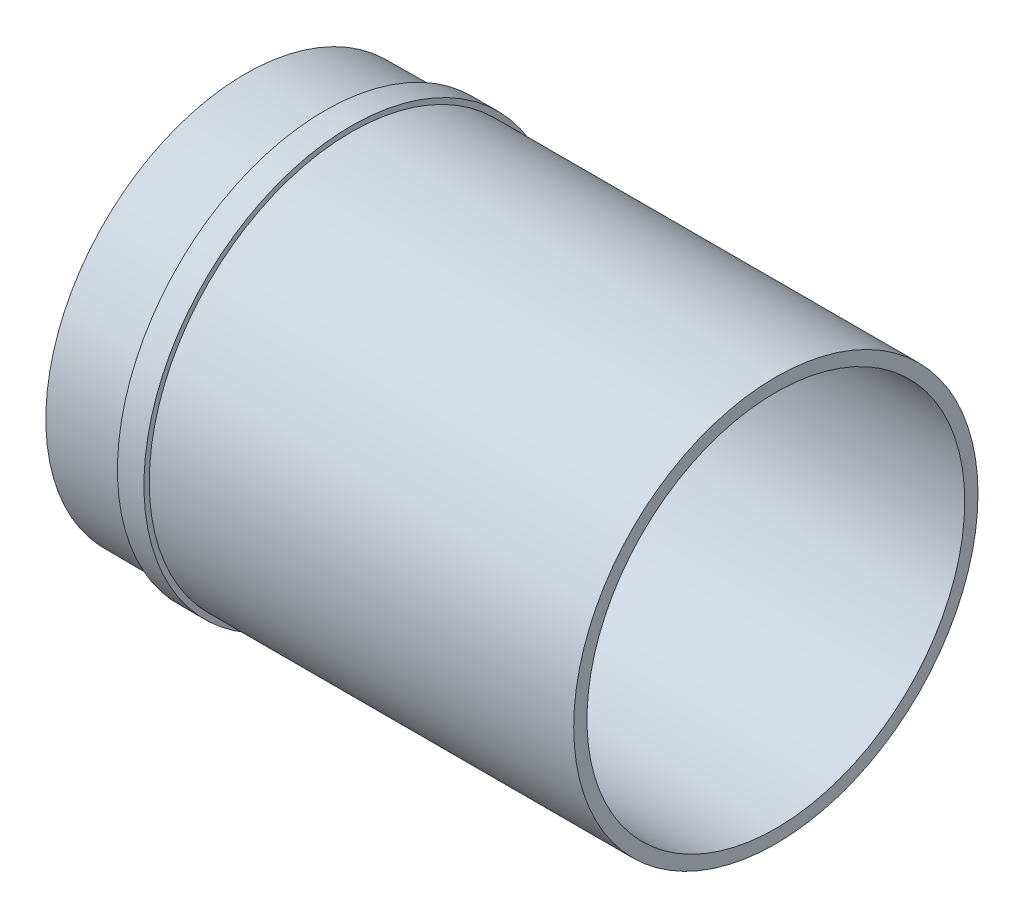
from build123d import *


with BuildPart() as part:
    # Sketch1 → Revolve1 (revolve)
    with BuildSketch(Plane.XY):
        with BuildLine():
            Line((0, 3633.5), (0, 3635.5))
            ThreePointArc((0, 3635.5), (-5.000004729, 3635.496561675), (-10, 3635.486246708))
            Line((-10, 3635.486246708), (-10, 3632.686236107))
            ThreePointArc((-10, 3632.686236107), (-25.000213137, 3632.613973345), (-40, 3632.479771451))
            Line((-40, 3632.479771451), (-40, 3628.5))
            Line((-40, 3628.5), (160, 3628.5))
            Line((160, 3628.5), (160, 3633.5))
            Line((160, 3633.5), (0, 3633.5))
        make_face()
    revolve(axis=Axis((0, 3557.296761587, 0), (-1, 0, 0)))


solid = part.part
